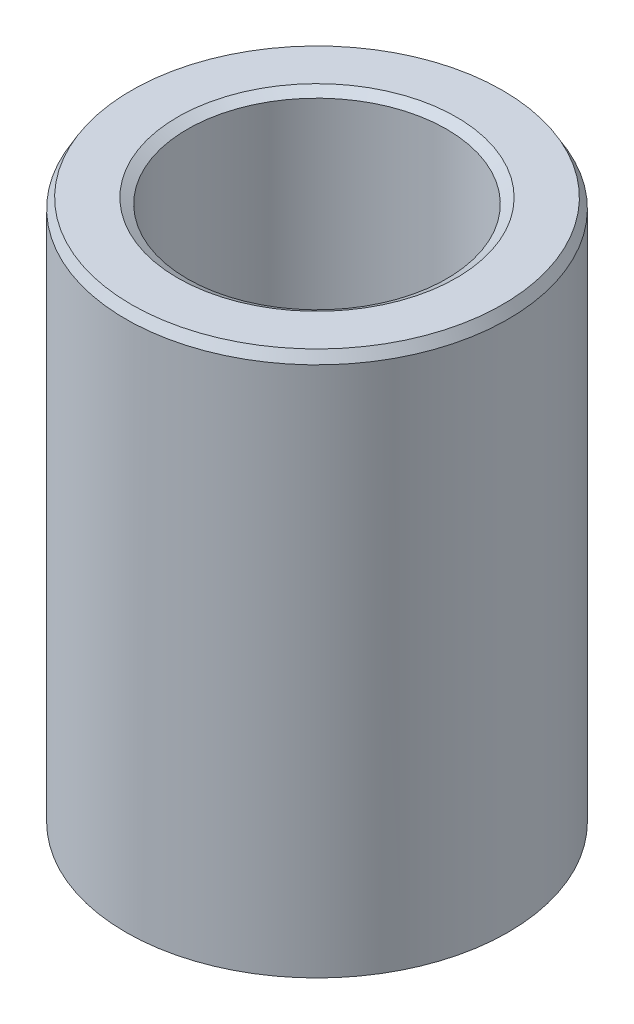
from build123d import *
from OCP.BRepFilletAPI import BRepFilletAPI_MakeChamfer

# Parameters (mm, degrees)
SKETCH1_R           = 35
BOSS_EXTRUDE1_DEPTH = 100.02088155
SKETCH2_R           = 23.729864591
CUT_EXTRUDE1_DEPTH  = 112.598282899
CHAMFER1_SIZE       = 1.789424395
CHAMFER1_SIZE2      = 1.033124656


with BuildPart() as part:
    # Sketch1 → Boss-Extrude1 (new body)
    with BuildSketch(Plane(origin=(0, 0, 0), x_dir=(1, 0, 0), z_dir=(0, 1, 0))):
        Circle(SKETCH1_R)
    extrude(amount=BOSS_EXTRUDE1_DEPTH)

    # Sketch2 → Cut-Extrude1 (cut, through all)
    with BuildSketch(Plane(origin=(0, 0, 0), x_dir=(1, 0, 0), z_dir=(0, 1, 0))):
        Circle(SKETCH2_R)
    extrude(amount=CUT_EXTRUDE1_DEPTH, mode=Mode.SUBTRACT)

    # Chamfer1: one chamfer whose edges measure the first distance from different faces: ONE call of the kernel's chamfer builder (chamfer() names one face for all edges)
    chamfer1_edges_1 = [part.edges().sort_by_distance(p)[0] for p in [
        (-23.729864591, 100.02088155, 0),
    ]]
    chamfer1_side_1 = [part.faces().sort_by_distance(p)[0] for p in [
        (-34.010050506, 100.02088155, 0),
    ]]
    chamfer1_edges_2 = [part.edges().sort_by_distance(p)[0] for p in [
        (-23.729864591, 0, 0),
    ]]
    chamfer1_side_2 = [part.faces().sort_by_distance(p)[0] for p in [
        (-23.729864591, 50.010440775, 0),
    ]]
    chamfer1_edges_3 = [part.edges().sort_by_distance(p)[0] for p in [
        (-35, 0, 0),
    ]]
    chamfer1_side_3 = [part.faces().sort_by_distance(p)[0] for p in [
        (-34.010050506, 0, 0),
    ]]
    chamfer1_edges_4 = [part.edges().sort_by_distance(p)[0] for p in [
        (-35, 100.02088155, 0),
    ]]
    chamfer1_side_4 = [part.faces().sort_by_distance(p)[0] for p in [
        (-35, 50.010440775, 0),
    ]]
    chamfer1 = BRepFilletAPI_MakeChamfer(part.part.solid().wrapped)
    for e in chamfer1_edges_1:
        chamfer1.Add(CHAMFER1_SIZE, CHAMFER1_SIZE2, e.wrapped, chamfer1_side_1[0].wrapped)  # the first distance lies on this face
    for e in chamfer1_edges_2:
        chamfer1.Add(CHAMFER1_SIZE, CHAMFER1_SIZE2, e.wrapped, chamfer1_side_2[0].wrapped)  # the first distance lies on this face
    for e in chamfer1_edges_3:
        chamfer1.Add(CHAMFER1_SIZE, CHAMFER1_SIZE2, e.wrapped, chamfer1_side_3[0].wrapped)  # the first distance lies on this face
    for e in chamfer1_edges_4:
        chamfer1.Add(CHAMFER1_SIZE, CHAMFER1_SIZE2, e.wrapped, chamfer1_side_4[0].wrapped)  # the first distance lies on this face
    add(Compound.cast(chamfer1.Shape()), mode=Mode.REPLACE)


solid = part.part
